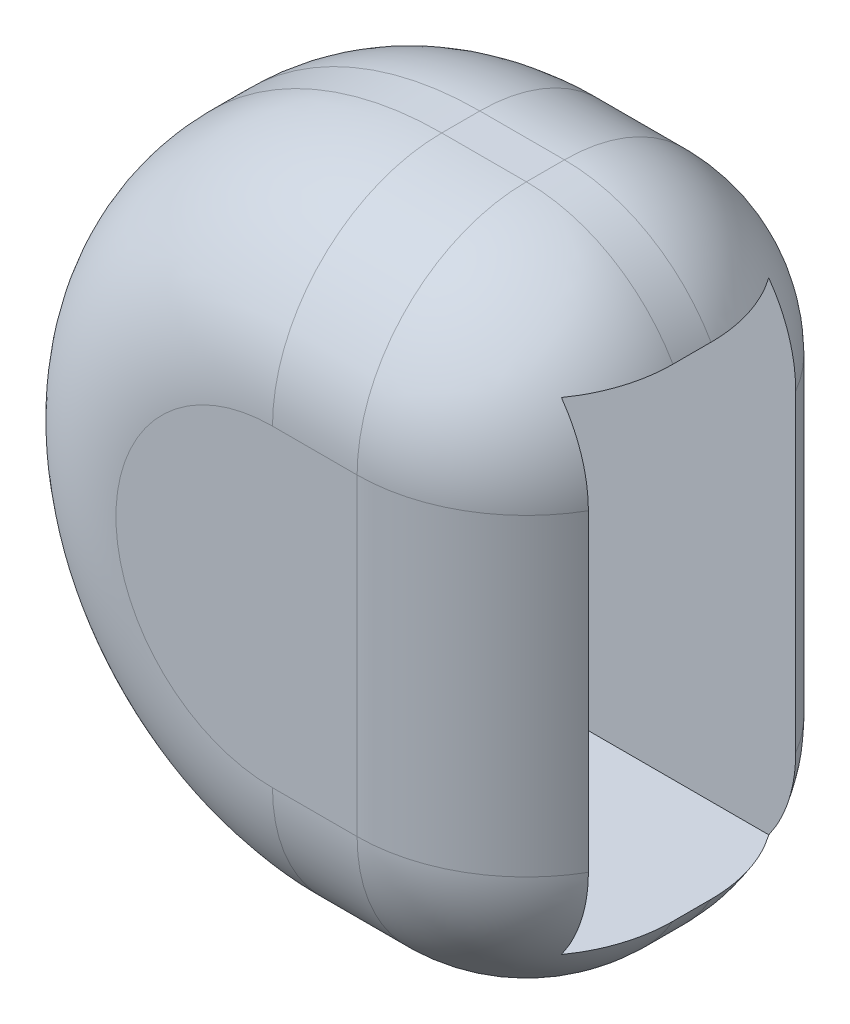
from build123d import *

# Parameters (mm, degrees)
BOSS_EXTRUDE1_DEPTH = 12.25
BOSS_EXTRUDE2_DEPTH = 5
LPATTERN1_COUNT     = 2
LPATTERN1_PITCH     = 17.25
FILLET11_R          = 10
FILLET12_R          = 10


with BuildPart() as part:
    # Sketch1 → Boss-Extrude1 (new body)
    with BuildSketch(Plane.XY):
        with BuildLine():
            Line((0, 19.25), (15, 19.25))
            Line((15, 19.25), (15, 14.25))
            Line((15, 14.25), (0, 14.25))
            ThreePointArc((0, 14.25), (-14.25, 0), (0, -14.25))
            Line((0, -14.25), (15, -14.25))
            Line((15, -14.25), (15, -19.25))
            Line((15, -19.25), (0, -19.25))
            ThreePointArc((0, -19.25), (-19.25, 0), (0, 19.25))
        make_face()
    extrude(amount=BOSS_EXTRUDE1_DEPTH)

    # Sketch2 → Boss-Extrude2 (add)
    with BuildSketch(Plane.XY.offset(12.25)):
        with BuildLine():
            Line((0, 19.25), (15, 19.25))
            Line((15, 19.25), (15, 14.25))
            Line((15, 14.25), (15, -14.25))
            Line((15, -14.25), (15, -19.25))
            Line((15, -19.25), (0, -19.25))
            ThreePointArc((0, -19.25), (-19.25, 0), (0, 19.25))
        make_face()
    boss_extrude2 = extrude(amount=BOSS_EXTRUDE2_DEPTH)

    # LPattern1: Boss-Extrude2 ×2
    with Locations(*[(0, 0, -i * LPATTERN1_PITCH) for i in range(1, LPATTERN1_COUNT)]):
        add(boss_extrude2)

    # Fillet11
    fillet11_edges = [part.edges().sort_by_distance(p)[0] for p in [
        (-19.25, 0, 17.25),
        (7.5, -19.25, 17.25),
        (7.5, 19.25, 17.25),
        (-19.25, 0, -5),
        (7.5, -19.25, -5),
        (7.5, 19.25, -5),
    ]]
    fillet(fillet11_edges, radius=FILLET11_R)

    # Fillet12
    # the kernel refuses this fillet: 10 mm, written as the material it takes off along each edge
    with BuildSketch(Plane(origin=(15, -9.25, 7.25), x_dir=(0, -1, 0), z_dir=(0, 0, -1))) as fillet12_piece_1:
        with BuildLine():
            CenterArc((10 - FILLET12_R, FILLET12_R), FILLET12_R, 270, 90)
            Line((10, FILLET12_R), (10, 0))
            Line((10, 0), (10 - FILLET12_R, 0))
        make_face()
    revolve(axis=Axis((15, -9.25, 7.25), (-1, 0, 0)), revolution_arc=90, mode=Mode.SUBTRACT)
    with BuildSketch(Plane(origin=(15, 9.25, 17.25), x_dir=(0, 0, -1), z_dir=(0, -1, 0)), Plane(origin=(15, -9.25, -5), x_dir=(0, 0, 1), z_dir=(0, 1, 0))) as fillet12_piece_2:
        with BuildLine():
            CenterArc((FILLET12_R, -FILLET12_R), FILLET12_R, 90, 90)
            Line((0, -FILLET12_R), (0, 0))
            Line((0, 0), (FILLET12_R, 0))
        make_face()
    extrude(amount=18.5, mode=Mode.SUBTRACT)
    with BuildSketch(Plane(origin=(15, 9.25, 7.25), x_dir=(0, 1, 0), z_dir=(0, 0, -1))) as fillet12_piece_3:
        with BuildLine():
            CenterArc((10 - FILLET12_R, -FILLET12_R), FILLET12_R, 360, 90)
            Line((10, -FILLET12_R), (10, 0))
            Line((10, 0), (10 - FILLET12_R, 0))
        make_face()
    revolve(axis=Axis((15, 9.25, 7.25), (1, 0, 0)), revolution_arc=90, mode=Mode.SUBTRACT)
    with BuildSketch(Plane(origin=(15, 19.25, 7.25), x_dir=(-1, 0, 0), z_dir=(0, 0, -1)), Plane(origin=(15, -19.25, 7.25), x_dir=(0, 1, 0), z_dir=(0, 0, -1))) as fillet12_piece_4:
        with BuildLine():
            CenterArc((FILLET12_R, -FILLET12_R), FILLET12_R, 90, 90)
            Line((0, -FILLET12_R), (0, 0))
            Line((0, 0), (FILLET12_R, 0))
        make_face()
    extrude(amount=2.25, mode=Mode.SUBTRACT)
    with BuildSketch(Plane(origin=(15, 9.25, 5), x_dir=(0, 1, 0), z_dir=(0, 0, 1))) as fillet12_piece_5:
        with BuildLine():
            CenterArc((10 - FILLET12_R, FILLET12_R), FILLET12_R, 270, 90)
            Line((10, FILLET12_R), (10, 0))
            Line((10, 0), (10 - FILLET12_R, 0))
        make_face()
    revolve(axis=Axis((15, 9.25, 5), (-1, 0, 0)), revolution_arc=90, mode=Mode.SUBTRACT)
    with BuildSketch(Plane(origin=(15, -9.25, 5), x_dir=(0, -1, 0), z_dir=(0, 0, 1))) as fillet12_piece_6:
        with BuildLine():
            CenterArc((10 - FILLET12_R, -FILLET12_R), FILLET12_R, 360, 90)
            Line((10, -FILLET12_R), (10, 0))
            Line((10, 0), (10 - FILLET12_R, 0))
        make_face()
    revolve(axis=Axis((15, -9.25, 5), (1, 0, 0)), revolution_arc=90, mode=Mode.SUBTRACT)


solid = part.part
